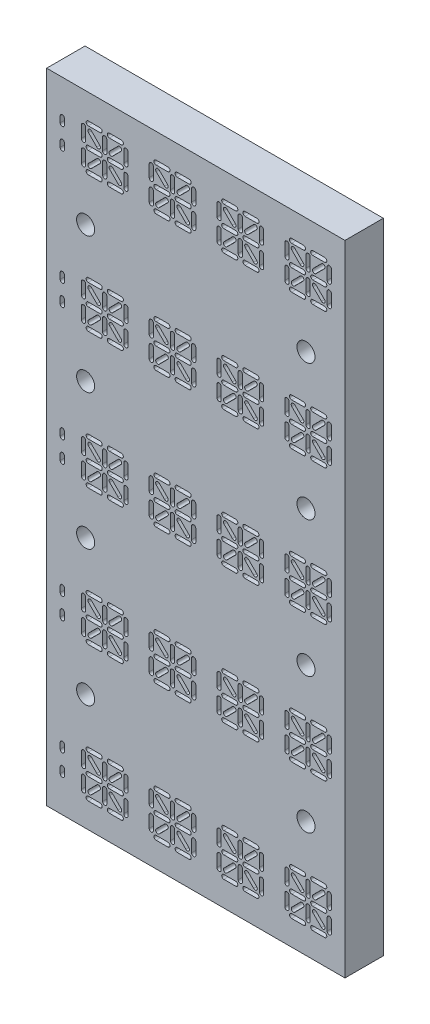
from build123d import *

# Parameters (mm, degrees)
SKETCH1_W             = 44.704
SKETCH1_H             = 11.90752
BOSS_EXTRUDE1_DEPTH   = 5.7531
LPATTERN1_COUNT       = 5
LPATTERN1_PITCH       = 20.32
SKETCH2_W             = 44.704
SKETCH2_H             = 8.41248
SKETCH2_H_2           = 1.27
BOSS_EXTRUDE2_DEPTH   = 5.7531
F_2_CLEARANCE_HOLE1_D = 2.7051


with BuildPart() as part:
    # Sketch1 → Boss-Extrude1 (new body)
    with BuildSketch(Plane.XY):
        with Locations((313.537231739, 231.557630322)):
            Rectangle(SKETCH1_W, SKETCH1_H)
        with BuildLine():
            Line((297.417977684, 228.700130322), (299.195977684, 228.700130322))
            ThreePointArc((299.195977684, 228.700130322), (299.513477684, 228.382630322), (299.195977684, 228.065130322))
            Line((299.195977684, 228.065130322), (297.417977684, 228.065130322))
            ThreePointArc((297.417977684, 228.065130322), (297.100477684, 228.382630322), (297.417977684, 228.700130322))
        make_face(mode=Mode.SUBTRACT)
        with BuildLine():
            Line((300.592977684, 228.700130322), (302.370977684, 228.700130322))
            ThreePointArc((302.370977684, 228.700130322), (302.688477684, 228.382630322), (302.370977684, 228.065130322))
            Line((302.370977684, 228.065130322), (300.592977684, 228.065130322))
            ThreePointArc((300.592977684, 228.065130322), (300.275477684, 228.382630322), (300.592977684, 228.700130322))
        make_face(mode=Mode.SUBTRACT)
        with BuildLine():
            Line((301.890962182, 229.11700599), (300.633726325, 230.374241847))
            ThreePointArc((300.633726325, 230.374241847), (300.633726325, 230.823254654), (301.082739131, 230.823254654))
            Line((301.082739131, 230.823254654), (302.339974988, 229.566018797))
            ThreePointArc((302.339974988, 229.566018797), (302.339974988, 229.11700599), (301.890962182, 229.11700599))
        make_face(mode=Mode.SUBTRACT)
        with BuildLine():
            Line((299.567231739, 229.081130322), (299.567231739, 230.859130322))
            ThreePointArc((299.567231739, 230.859130322), (299.884731739, 231.176630322), (300.202231739, 230.859130322))
            Line((300.202231739, 230.859130322), (300.202231739, 229.081130322))
            ThreePointArc((300.202231739, 229.081130322), (299.884731739, 228.763630322), (299.567231739, 229.081130322))
        make_face(mode=Mode.SUBTRACT)
        with BuildLine():
            Line((299.160102016, 230.369368875), (297.902866159, 229.112133018))
            ThreePointArc((297.902866159, 229.112133018), (297.453853353, 229.112133018), (297.453853353, 229.561145824))
            Line((297.453853353, 229.561145824), (298.71108921, 230.818381681))
            ThreePointArc((298.71108921, 230.818381681), (299.160102016, 230.818381681), (299.160102016, 230.369368875))
        make_face(mode=Mode.SUBTRACT)
        with BuildLine():
            Line((296.392231739, 229.081130322), (296.392231739, 230.859130322))
            ThreePointArc((296.392231739, 230.859130322), (296.709731739, 231.176630322), (297.027231739, 230.859130322))
            Line((297.027231739, 230.859130322), (297.027231739, 229.081130322))
            ThreePointArc((297.027231739, 229.081130322), (296.709731739, 228.763630322), (296.392231739, 229.081130322))
        make_face(mode=Mode.SUBTRACT)
        with BuildLine():
            Line((303.377231739, 230.859130322), (303.377231739, 229.081130322))
            ThreePointArc((303.377231739, 229.081130322), (303.059731739, 228.763630322), (302.742231739, 229.081130322))
            Line((302.742231739, 229.081130322), (302.742231739, 230.859130322))
            ThreePointArc((302.742231739, 230.859130322), (303.059731739, 231.176630322), (303.377231739, 230.859130322))
        make_face(mode=Mode.SUBTRACT)
        with BuildLine():
            Line((302.370977684, 231.240130322), (300.592977684, 231.240130322))
            ThreePointArc((300.592977684, 231.240130322), (300.275477684, 231.557630322), (300.592977684, 231.875130322))
            Line((300.592977684, 231.875130322), (302.370977684, 231.875130322))
            ThreePointArc((302.370977684, 231.875130322), (302.688477684, 231.557630322), (302.370977684, 231.240130322))
        make_face(mode=Mode.SUBTRACT)
        with BuildLine():
            Line((303.377231739, 234.034130322), (303.377231739, 232.256130322))
            ThreePointArc((303.377231739, 232.256130322), (303.059731739, 231.938630322), (302.742231739, 232.256130322))
            Line((302.742231739, 232.256130322), (302.742231739, 234.034130322))
            ThreePointArc((302.742231739, 234.034130322), (303.059731739, 234.351630322), (303.377231739, 234.034130322))
        make_face(mode=Mode.SUBTRACT)
        with BuildLine():
            Line((302.335102016, 233.55411482), (301.077866159, 232.296878963))
            ThreePointArc((301.077866159, 232.296878963), (300.628853353, 232.296878963), (300.628853353, 232.745891769))
            Line((300.628853353, 232.745891769), (301.88608921, 234.003127626))
            ThreePointArc((301.88608921, 234.003127626), (302.335102016, 234.003127626), (302.335102016, 233.55411482))
        make_face(mode=Mode.SUBTRACT)
        with BuildLine():
            Line((302.370977684, 234.415130322), (300.592977684, 234.415130322))
            ThreePointArc((300.592977684, 234.415130322), (300.275477684, 234.732630322), (300.592977684, 235.050130322))
            Line((300.592977684, 235.050130322), (302.370977684, 235.050130322))
            ThreePointArc((302.370977684, 235.050130322), (302.688477684, 234.732630322), (302.370977684, 234.415130322))
        make_face(mode=Mode.SUBTRACT)
        with BuildLine():
            Line((300.202231739, 234.034130322), (300.202231739, 232.256130322))
            ThreePointArc((300.202231739, 232.256130322), (299.884731739, 231.938630322), (299.567231739, 232.256130322))
            Line((299.567231739, 232.256130322), (299.567231739, 234.034130322))
            ThreePointArc((299.567231739, 234.034130322), (299.884731739, 234.351630322), (300.202231739, 234.034130322))
        make_face(mode=Mode.SUBTRACT)
        with BuildLine():
            Line((297.417977684, 231.875130322), (299.195977684, 231.875130322))
            ThreePointArc((299.195977684, 231.875130322), (299.513477684, 231.557630322), (299.195977684, 231.240130322))
            Line((299.195977684, 231.240130322), (297.417977684, 231.240130322))
            ThreePointArc((297.417977684, 231.240130322), (297.100477684, 231.557630322), (297.417977684, 231.875130322))
        make_face(mode=Mode.SUBTRACT)
        with BuildLine():
            Line((298.706216237, 232.29200599), (297.44898038, 233.549241847))
            ThreePointArc((297.44898038, 233.549241847), (297.44898038, 233.998254654), (297.897993186, 233.998254654))
            Line((297.897993186, 233.998254654), (299.155229043, 232.741018797))
            ThreePointArc((299.155229043, 232.741018797), (299.155229043, 232.29200599), (298.706216237, 232.29200599))
        make_face(mode=Mode.SUBTRACT)
        with BuildLine():
            Line((296.392231739, 232.256130322), (296.392231739, 234.034130322))
            ThreePointArc((296.392231739, 234.034130322), (296.709731739, 234.351630322), (297.027231739, 234.034130322))
            Line((297.027231739, 234.034130322), (297.027231739, 232.256130322))
            ThreePointArc((297.027231739, 232.256130322), (296.709731739, 231.938630322), (296.392231739, 232.256130322))
        make_face(mode=Mode.SUBTRACT)
        with BuildLine():
            Line((297.417977684, 235.050130322), (299.195977684, 235.050130322))
            ThreePointArc((299.195977684, 235.050130322), (299.513477684, 234.732630322), (299.195977684, 234.415130322))
            Line((299.195977684, 234.415130322), (297.417977684, 234.415130322))
            ThreePointArc((297.417977684, 234.415130322), (297.100477684, 234.732630322), (297.417977684, 235.050130322))
        make_face(mode=Mode.SUBTRACT)
        with BuildLine():
            Line((293.217231739, 232.700630322), (293.217231739, 233.589630322))
            ThreePointArc((293.217231739, 233.589630322), (293.534731739, 233.907130322), (293.852231739, 233.589630322))
            Line((293.852231739, 233.589630322), (293.852231739, 232.700630322))
            ThreePointArc((293.852231739, 232.700630322), (293.534731739, 232.383130322), (293.217231739, 232.700630322))
        make_face(mode=Mode.SUBTRACT)
        with BuildLine():
            Line((293.852231739, 230.414630322), (293.852231739, 229.525630322))
            ThreePointArc((293.852231739, 229.525630322), (293.534731739, 229.208130322), (293.217231739, 229.525630322))
            Line((293.217231739, 229.525630322), (293.217231739, 230.414630322))
            ThreePointArc((293.217231739, 230.414630322), (293.534731739, 230.732130322), (293.852231739, 230.414630322))
        make_face(mode=Mode.SUBTRACT)
        with BuildLine():
            Line((307.577977684, 228.700130322), (309.355977684, 228.700130322))
            ThreePointArc((309.355977684, 228.700130322), (309.673477684, 228.382630322), (309.355977684, 228.065130322))
            Line((309.355977684, 228.065130322), (307.577977684, 228.065130322))
            ThreePointArc((307.577977684, 228.065130322), (307.260477684, 228.382630322), (307.577977684, 228.700130322))
        make_face(mode=Mode.SUBTRACT)
        with BuildLine():
            Line((310.752977684, 228.700130322), (312.530977684, 228.700130322))
            ThreePointArc((312.530977684, 228.700130322), (312.848477684, 228.382630322), (312.530977684, 228.065130322))
            Line((312.530977684, 228.065130322), (310.752977684, 228.065130322))
            ThreePointArc((310.752977684, 228.065130322), (310.435477684, 228.382630322), (310.752977684, 228.700130322))
        make_face(mode=Mode.SUBTRACT)
        with BuildLine():
            Line((312.050962182, 229.11700599), (310.793726325, 230.374241847))
            ThreePointArc((310.793726325, 230.374241847), (310.793726325, 230.823254654), (311.242739131, 230.823254654))
            Line((311.242739131, 230.823254654), (312.499974988, 229.566018797))
            ThreePointArc((312.499974988, 229.566018797), (312.499974988, 229.11700599), (312.050962182, 229.11700599))
        make_face(mode=Mode.SUBTRACT)
        with BuildLine():
            Line((309.727231739, 229.081130322), (309.727231739, 230.859130322))
            ThreePointArc((309.727231739, 230.859130322), (310.044731739, 231.176630322), (310.362231739, 230.859130322))
            Line((310.362231739, 230.859130322), (310.362231739, 229.081130322))
            ThreePointArc((310.362231739, 229.081130322), (310.044731739, 228.763630322), (309.727231739, 229.081130322))
        make_face(mode=Mode.SUBTRACT)
        with BuildLine():
            Line((309.320102016, 230.369368875), (308.062866159, 229.112133018))
            ThreePointArc((308.062866159, 229.112133018), (307.613853353, 229.112133018), (307.613853353, 229.561145824))
            Line((307.613853353, 229.561145824), (308.87108921, 230.818381681))
            ThreePointArc((308.87108921, 230.818381681), (309.320102016, 230.818381681), (309.320102016, 230.369368875))
        make_face(mode=Mode.SUBTRACT)
        with BuildLine():
            Line((306.552231739, 229.081130322), (306.552231739, 230.859130322))
            ThreePointArc((306.552231739, 230.859130322), (306.869731739, 231.176630322), (307.187231739, 230.859130322))
            Line((307.187231739, 230.859130322), (307.187231739, 229.081130322))
            ThreePointArc((307.187231739, 229.081130322), (306.869731739, 228.763630322), (306.552231739, 229.081130322))
        make_face(mode=Mode.SUBTRACT)
        with BuildLine():
            Line((313.537231739, 230.859130322), (313.537231739, 229.081130322))
            ThreePointArc((313.537231739, 229.081130322), (313.219731739, 228.763630322), (312.902231739, 229.081130322))
            Line((312.902231739, 229.081130322), (312.902231739, 230.859130322))
            ThreePointArc((312.902231739, 230.859130322), (313.219731739, 231.176630322), (313.537231739, 230.859130322))
        make_face(mode=Mode.SUBTRACT)
        with BuildLine():
            Line((312.530977684, 231.240130322), (310.752977684, 231.240130322))
            ThreePointArc((310.752977684, 231.240130322), (310.435477684, 231.557630322), (310.752977684, 231.875130322))
            Line((310.752977684, 231.875130322), (312.530977684, 231.875130322))
            ThreePointArc((312.530977684, 231.875130322), (312.848477684, 231.557630322), (312.530977684, 231.240130322))
        make_face(mode=Mode.SUBTRACT)
        with BuildLine():
            Line((313.537231739, 234.034130322), (313.537231739, 232.256130322))
            ThreePointArc((313.537231739, 232.256130322), (313.219731739, 231.938630322), (312.902231739, 232.256130322))
            Line((312.902231739, 232.256130322), (312.902231739, 234.034130322))
            ThreePointArc((312.902231739, 234.034130322), (313.219731739, 234.351630322), (313.537231739, 234.034130322))
        make_face(mode=Mode.SUBTRACT)
        with BuildLine():
            Line((312.495102016, 233.55411482), (311.237866159, 232.296878963))
            ThreePointArc((311.237866159, 232.296878963), (310.788853353, 232.296878963), (310.788853353, 232.745891769))
            Line((310.788853353, 232.745891769), (312.04608921, 234.003127626))
            ThreePointArc((312.04608921, 234.003127626), (312.495102016, 234.003127626), (312.495102016, 233.55411482))
        make_face(mode=Mode.SUBTRACT)
        with BuildLine():
            Line((312.530977684, 234.415130322), (310.752977684, 234.415130322))
            ThreePointArc((310.752977684, 234.415130322), (310.435477684, 234.732630322), (310.752977684, 235.050130322))
            Line((310.752977684, 235.050130322), (312.530977684, 235.050130322))
            ThreePointArc((312.530977684, 235.050130322), (312.848477684, 234.732630322), (312.530977684, 234.415130322))
        make_face(mode=Mode.SUBTRACT)
        with BuildLine():
            Line((310.362231739, 234.034130322), (310.362231739, 232.256130322))
            ThreePointArc((310.362231739, 232.256130322), (310.044731739, 231.938630322), (309.727231739, 232.256130322))
            Line((309.727231739, 232.256130322), (309.727231739, 234.034130322))
            ThreePointArc((309.727231739, 234.034130322), (310.044731739, 234.351630322), (310.362231739, 234.034130322))
        make_face(mode=Mode.SUBTRACT)
        with BuildLine():
            Line((307.577977684, 231.875130322), (309.355977684, 231.875130322))
            ThreePointArc((309.355977684, 231.875130322), (309.673477684, 231.557630322), (309.355977684, 231.240130322))
            Line((309.355977684, 231.240130322), (307.577977684, 231.240130322))
            ThreePointArc((307.577977684, 231.240130322), (307.260477684, 231.557630322), (307.577977684, 231.875130322))
        make_face(mode=Mode.SUBTRACT)
        with BuildLine():
            Line((308.866216237, 232.29200599), (307.60898038, 233.549241847))
            ThreePointArc((307.60898038, 233.549241847), (307.60898038, 233.998254654), (308.057993186, 233.998254654))
            Line((308.057993186, 233.998254654), (309.315229043, 232.741018797))
            ThreePointArc((309.315229043, 232.741018797), (309.315229043, 232.29200599), (308.866216237, 232.29200599))
        make_face(mode=Mode.SUBTRACT)
        with BuildLine():
            Line((306.552231739, 232.256130322), (306.552231739, 234.034130322))
            ThreePointArc((306.552231739, 234.034130322), (306.869731739, 234.351630322), (307.187231739, 234.034130322))
            Line((307.187231739, 234.034130322), (307.187231739, 232.256130322))
            ThreePointArc((307.187231739, 232.256130322), (306.869731739, 231.938630322), (306.552231739, 232.256130322))
        make_face(mode=Mode.SUBTRACT)
        with BuildLine():
            Line((307.577977684, 235.050130322), (309.355977684, 235.050130322))
            ThreePointArc((309.355977684, 235.050130322), (309.673477684, 234.732630322), (309.355977684, 234.415130322))
            Line((309.355977684, 234.415130322), (307.577977684, 234.415130322))
            ThreePointArc((307.577977684, 234.415130322), (307.260477684, 234.732630322), (307.577977684, 235.050130322))
        make_face(mode=Mode.SUBTRACT)
        with BuildLine():
            Line((317.737977684, 228.700130322), (319.515977684, 228.700130322))
            ThreePointArc((319.515977684, 228.700130322), (319.833477684, 228.382630322), (319.515977684, 228.065130322))
            Line((319.515977684, 228.065130322), (317.737977684, 228.065130322))
            ThreePointArc((317.737977684, 228.065130322), (317.420477684, 228.382630322), (317.737977684, 228.700130322))
        make_face(mode=Mode.SUBTRACT)
        with BuildLine():
            Line((320.912977684, 228.700130322), (322.690977684, 228.700130322))
            ThreePointArc((322.690977684, 228.700130322), (323.008477684, 228.382630322), (322.690977684, 228.065130322))
            Line((322.690977684, 228.065130322), (320.912977684, 228.065130322))
            ThreePointArc((320.912977684, 228.065130322), (320.595477684, 228.382630322), (320.912977684, 228.700130322))
        make_face(mode=Mode.SUBTRACT)
        with BuildLine():
            Line((322.210962182, 229.11700599), (320.953726325, 230.374241847))
            ThreePointArc((320.953726325, 230.374241847), (320.953726325, 230.823254654), (321.402739131, 230.823254654))
            Line((321.402739131, 230.823254654), (322.659974988, 229.566018797))
            ThreePointArc((322.659974988, 229.566018797), (322.659974988, 229.11700599), (322.210962182, 229.11700599))
        make_face(mode=Mode.SUBTRACT)
        with BuildLine():
            Line((319.887231739, 229.081130322), (319.887231739, 230.859130322))
            ThreePointArc((319.887231739, 230.859130322), (320.204731739, 231.176630322), (320.522231739, 230.859130322))
            Line((320.522231739, 230.859130322), (320.522231739, 229.081130322))
            ThreePointArc((320.522231739, 229.081130322), (320.204731739, 228.763630322), (319.887231739, 229.081130322))
        make_face(mode=Mode.SUBTRACT)
        with BuildLine():
            Line((319.480102016, 230.369368875), (318.222866159, 229.112133018))
            ThreePointArc((318.222866159, 229.112133018), (317.773853353, 229.112133018), (317.773853353, 229.561145824))
            Line((317.773853353, 229.561145824), (319.03108921, 230.818381681))
            ThreePointArc((319.03108921, 230.818381681), (319.480102016, 230.818381681), (319.480102016, 230.369368875))
        make_face(mode=Mode.SUBTRACT)
        with BuildLine():
            Line((316.712231739, 229.081130322), (316.712231739, 230.859130322))
            ThreePointArc((316.712231739, 230.859130322), (317.029731739, 231.176630322), (317.347231739, 230.859130322))
            Line((317.347231739, 230.859130322), (317.347231739, 229.081130322))
            ThreePointArc((317.347231739, 229.081130322), (317.029731739, 228.763630322), (316.712231739, 229.081130322))
        make_face(mode=Mode.SUBTRACT)
        with BuildLine():
            Line((323.697231739, 230.859130322), (323.697231739, 229.081130322))
            ThreePointArc((323.697231739, 229.081130322), (323.379731739, 228.763630322), (323.062231739, 229.081130322))
            Line((323.062231739, 229.081130322), (323.062231739, 230.859130322))
            ThreePointArc((323.062231739, 230.859130322), (323.379731739, 231.176630322), (323.697231739, 230.859130322))
        make_face(mode=Mode.SUBTRACT)
        with BuildLine():
            Line((322.690977684, 231.240130322), (320.912977684, 231.240130322))
            ThreePointArc((320.912977684, 231.240130322), (320.595477684, 231.557630322), (320.912977684, 231.875130322))
            Line((320.912977684, 231.875130322), (322.690977684, 231.875130322))
            ThreePointArc((322.690977684, 231.875130322), (323.008477684, 231.557630322), (322.690977684, 231.240130322))
        make_face(mode=Mode.SUBTRACT)
        with BuildLine():
            Line((323.697231739, 234.034130322), (323.697231739, 232.256130322))
            ThreePointArc((323.697231739, 232.256130322), (323.379731739, 231.938630322), (323.062231739, 232.256130322))
            Line((323.062231739, 232.256130322), (323.062231739, 234.034130322))
            ThreePointArc((323.062231739, 234.034130322), (323.379731739, 234.351630322), (323.697231739, 234.034130322))
        make_face(mode=Mode.SUBTRACT)
        with BuildLine():
            Line((322.655102016, 233.55411482), (321.397866159, 232.296878963))
            ThreePointArc((321.397866159, 232.296878963), (320.948853353, 232.296878963), (320.948853353, 232.745891769))
            Line((320.948853353, 232.745891769), (322.20608921, 234.003127626))
            ThreePointArc((322.20608921, 234.003127626), (322.655102016, 234.003127626), (322.655102016, 233.55411482))
        make_face(mode=Mode.SUBTRACT)
        with BuildLine():
            Line((322.690977684, 234.415130322), (320.912977684, 234.415130322))
            ThreePointArc((320.912977684, 234.415130322), (320.595477684, 234.732630322), (320.912977684, 235.050130322))
            Line((320.912977684, 235.050130322), (322.690977684, 235.050130322))
            ThreePointArc((322.690977684, 235.050130322), (323.008477684, 234.732630322), (322.690977684, 234.415130322))
        make_face(mode=Mode.SUBTRACT)
        with BuildLine():
            Line((320.522231739, 234.034130322), (320.522231739, 232.256130322))
            ThreePointArc((320.522231739, 232.256130322), (320.204731739, 231.938630322), (319.887231739, 232.256130322))
            Line((319.887231739, 232.256130322), (319.887231739, 234.034130322))
            ThreePointArc((319.887231739, 234.034130322), (320.204731739, 234.351630322), (320.522231739, 234.034130322))
        make_face(mode=Mode.SUBTRACT)
        with BuildLine():
            Line((317.737977684, 231.875130322), (319.515977684, 231.875130322))
            ThreePointArc((319.515977684, 231.875130322), (319.833477684, 231.557630322), (319.515977684, 231.240130322))
            Line((319.515977684, 231.240130322), (317.737977684, 231.240130322))
            ThreePointArc((317.737977684, 231.240130322), (317.420477684, 231.557630322), (317.737977684, 231.875130322))
        make_face(mode=Mode.SUBTRACT)
        with BuildLine():
            Line((319.026216237, 232.29200599), (317.76898038, 233.549241847))
            ThreePointArc((317.76898038, 233.549241847), (317.76898038, 233.998254654), (318.217993186, 233.998254654))
            Line((318.217993186, 233.998254654), (319.475229043, 232.741018797))
            ThreePointArc((319.475229043, 232.741018797), (319.475229043, 232.29200599), (319.026216237, 232.29200599))
        make_face(mode=Mode.SUBTRACT)
        with BuildLine():
            Line((316.712231739, 232.256130322), (316.712231739, 234.034130322))
            ThreePointArc((316.712231739, 234.034130322), (317.029731739, 234.351630322), (317.347231739, 234.034130322))
            Line((317.347231739, 234.034130322), (317.347231739, 232.256130322))
            ThreePointArc((317.347231739, 232.256130322), (317.029731739, 231.938630322), (316.712231739, 232.256130322))
        make_face(mode=Mode.SUBTRACT)
        with BuildLine():
            Line((317.737977684, 235.050130322), (319.515977684, 235.050130322))
            ThreePointArc((319.515977684, 235.050130322), (319.833477684, 234.732630322), (319.515977684, 234.415130322))
            Line((319.515977684, 234.415130322), (317.737977684, 234.415130322))
            ThreePointArc((317.737977684, 234.415130322), (317.420477684, 234.732630322), (317.737977684, 235.050130322))
        make_face(mode=Mode.SUBTRACT)
        with BuildLine():
            Line((327.897977684, 228.700130322), (329.675977684, 228.700130322))
            ThreePointArc((329.675977684, 228.700130322), (329.993477684, 228.382630322), (329.675977684, 228.065130322))
            Line((329.675977684, 228.065130322), (327.897977684, 228.065130322))
            ThreePointArc((327.897977684, 228.065130322), (327.580477684, 228.382630322), (327.897977684, 228.700130322))
        make_face(mode=Mode.SUBTRACT)
        with BuildLine():
            Line((331.072977684, 228.700130322), (332.850977684, 228.700130322))
            ThreePointArc((332.850977684, 228.700130322), (333.168477684, 228.382630322), (332.850977684, 228.065130322))
            Line((332.850977684, 228.065130322), (331.072977684, 228.065130322))
            ThreePointArc((331.072977684, 228.065130322), (330.755477684, 228.382630322), (331.072977684, 228.700130322))
        make_face(mode=Mode.SUBTRACT)
        with BuildLine():
            Line((332.370962182, 229.11700599), (331.113726325, 230.374241847))
            ThreePointArc((331.113726325, 230.374241847), (331.113726325, 230.823254654), (331.562739131, 230.823254654))
            Line((331.562739131, 230.823254654), (332.819974988, 229.566018797))
            ThreePointArc((332.819974988, 229.566018797), (332.819974988, 229.11700599), (332.370962182, 229.11700599))
        make_face(mode=Mode.SUBTRACT)
        with BuildLine():
            Line((330.047231739, 229.081130322), (330.047231739, 230.859130322))
            ThreePointArc((330.047231739, 230.859130322), (330.364731739, 231.176630322), (330.682231739, 230.859130322))
            Line((330.682231739, 230.859130322), (330.682231739, 229.081130322))
            ThreePointArc((330.682231739, 229.081130322), (330.364731739, 228.763630322), (330.047231739, 229.081130322))
        make_face(mode=Mode.SUBTRACT)
        with BuildLine():
            Line((329.640102016, 230.369368875), (328.382866159, 229.112133018))
            ThreePointArc((328.382866159, 229.112133018), (327.933853353, 229.112133018), (327.933853353, 229.561145824))
            Line((327.933853353, 229.561145824), (329.19108921, 230.818381681))
            ThreePointArc((329.19108921, 230.818381681), (329.640102016, 230.818381681), (329.640102016, 230.369368875))
        make_face(mode=Mode.SUBTRACT)
        with BuildLine():
            Line((326.872231739, 229.081130322), (326.872231739, 230.859130322))
            ThreePointArc((326.872231739, 230.859130322), (327.189731739, 231.176630322), (327.507231739, 230.859130322))
            Line((327.507231739, 230.859130322), (327.507231739, 229.081130322))
            ThreePointArc((327.507231739, 229.081130322), (327.189731739, 228.763630322), (326.872231739, 229.081130322))
        make_face(mode=Mode.SUBTRACT)
        with BuildLine():
            Line((333.857231739, 230.859130322), (333.857231739, 229.081130322))
            ThreePointArc((333.857231739, 229.081130322), (333.539731739, 228.763630322), (333.222231739, 229.081130322))
            Line((333.222231739, 229.081130322), (333.222231739, 230.859130322))
            ThreePointArc((333.222231739, 230.859130322), (333.539731739, 231.176630322), (333.857231739, 230.859130322))
        make_face(mode=Mode.SUBTRACT)
        with BuildLine():
            Line((332.850977684, 231.240130322), (331.072977684, 231.240130322))
            ThreePointArc((331.072977684, 231.240130322), (330.755477684, 231.557630322), (331.072977684, 231.875130322))
            Line((331.072977684, 231.875130322), (332.850977684, 231.875130322))
            ThreePointArc((332.850977684, 231.875130322), (333.168477684, 231.557630322), (332.850977684, 231.240130322))
        make_face(mode=Mode.SUBTRACT)
        with BuildLine():
            Line((333.857231739, 234.034130322), (333.857231739, 232.256130322))
            ThreePointArc((333.857231739, 232.256130322), (333.539731739, 231.938630322), (333.222231739, 232.256130322))
            Line((333.222231739, 232.256130322), (333.222231739, 234.034130322))
            ThreePointArc((333.222231739, 234.034130322), (333.539731739, 234.351630322), (333.857231739, 234.034130322))
        make_face(mode=Mode.SUBTRACT)
        with BuildLine():
            Line((332.815102016, 233.55411482), (331.557866159, 232.296878963))
            ThreePointArc((331.557866159, 232.296878963), (331.108853353, 232.296878963), (331.108853353, 232.745891769))
            Line((331.108853353, 232.745891769), (332.36608921, 234.003127626))
            ThreePointArc((332.36608921, 234.003127626), (332.815102016, 234.003127626), (332.815102016, 233.55411482))
        make_face(mode=Mode.SUBTRACT)
        with BuildLine():
            Line((332.850977684, 234.415130322), (331.072977684, 234.415130322))
            ThreePointArc((331.072977684, 234.415130322), (330.755477684, 234.732630322), (331.072977684, 235.050130322))
            Line((331.072977684, 235.050130322), (332.850977684, 235.050130322))
            ThreePointArc((332.850977684, 235.050130322), (333.168477684, 234.732630322), (332.850977684, 234.415130322))
        make_face(mode=Mode.SUBTRACT)
        with BuildLine():
            Line((330.682231739, 234.034130322), (330.682231739, 232.256130322))
            ThreePointArc((330.682231739, 232.256130322), (330.364731739, 231.938630322), (330.047231739, 232.256130322))
            Line((330.047231739, 232.256130322), (330.047231739, 234.034130322))
            ThreePointArc((330.047231739, 234.034130322), (330.364731739, 234.351630322), (330.682231739, 234.034130322))
        make_face(mode=Mode.SUBTRACT)
        with BuildLine():
            Line((327.897977684, 231.875130322), (329.675977684, 231.875130322))
            ThreePointArc((329.675977684, 231.875130322), (329.993477684, 231.557630322), (329.675977684, 231.240130322))
            Line((329.675977684, 231.240130322), (327.897977684, 231.240130322))
            ThreePointArc((327.897977684, 231.240130322), (327.580477684, 231.557630322), (327.897977684, 231.875130322))
        make_face(mode=Mode.SUBTRACT)
        with BuildLine():
            Line((329.186216237, 232.29200599), (327.92898038, 233.549241847))
            ThreePointArc((327.92898038, 233.549241847), (327.92898038, 233.998254654), (328.377993186, 233.998254654))
            Line((328.377993186, 233.998254654), (329.635229043, 232.741018797))
            ThreePointArc((329.635229043, 232.741018797), (329.635229043, 232.29200599), (329.186216237, 232.29200599))
        make_face(mode=Mode.SUBTRACT)
        with BuildLine():
            Line((326.872231739, 232.256130322), (326.872231739, 234.034130322))
            ThreePointArc((326.872231739, 234.034130322), (327.189731739, 234.351630322), (327.507231739, 234.034130322))
            Line((327.507231739, 234.034130322), (327.507231739, 232.256130322))
            ThreePointArc((327.507231739, 232.256130322), (327.189731739, 231.938630322), (326.872231739, 232.256130322))
        make_face(mode=Mode.SUBTRACT)
        with BuildLine():
            Line((327.897977684, 235.050130322), (329.675977684, 235.050130322))
            ThreePointArc((329.675977684, 235.050130322), (329.993477684, 234.732630322), (329.675977684, 234.415130322))
            Line((329.675977684, 234.415130322), (327.897977684, 234.415130322))
            ThreePointArc((327.897977684, 234.415130322), (327.580477684, 234.732630322), (327.897977684, 235.050130322))
        make_face(mode=Mode.SUBTRACT)
    extrude(amount=BOSS_EXTRUDE1_DEPTH)


with BuildPart() as lpattern1_1:
    # LPattern1: pattern copy
    add(part.part.moved(Location(Vector(0, -1, 0) * (1 * LPATTERN1_PITCH))))


with BuildPart() as lpattern1_2:
    # LPattern1: pattern copy
    add(part.part.moved(Location(Vector(0, -1, 0) * (2 * LPATTERN1_PITCH))))


with BuildPart() as lpattern1_3:
    # LPattern1: pattern copy
    add(part.part.moved(Location(Vector(0, -1, 0) * (3 * LPATTERN1_PITCH))))


with BuildPart() as lpattern1_4:
    # LPattern1: pattern copy
    add(part.part.moved(Location(Vector(0, -1, 0) * (4 * LPATTERN1_PITCH))))


with BuildPart() as part_1:
    add(part.part)

    add(lpattern1_1.part)  # Boss-Extrude2 merges LPattern1_1

    add(lpattern1_2.part)  # Boss-Extrude2 merges LPattern1_2

    add(lpattern1_3.part)  # Boss-Extrude2 merges LPattern1_3

    add(lpattern1_4.part)  # Boss-Extrude2 merges LPattern1_4
    # Sketch2 → Boss-Extrude2 (add)
    with BuildSketch(Plane.XY.offset(5.7531)):
        with Locations((313.537231739, 221.397630322)):
            Rectangle(SKETCH2_W, SKETCH2_H)
        with Locations((313.537231739, 201.077630322)):
            Rectangle(SKETCH2_W, SKETCH2_H)
        with Locations((313.537231739, 180.757630322)):
            Rectangle(SKETCH2_W, SKETCH2_H)
        with Locations((313.537231739, 160.437630322)):
            Rectangle(SKETCH2_W, SKETCH2_H)
        with Locations((313.537231739, 238.146390322)):
            Rectangle(SKETCH2_W, SKETCH2_H_2)
        with Locations((313.537231739, 143.688870322)):
            Rectangle(SKETCH2_W, SKETCH2_H_2)
    extrude(amount=-BOSS_EXTRUDE2_DEPTH)

    # #2 Clearance Hole1 (through all)
    with Locations(Plane.XY.offset(5.7531)):
        with Locations((297.027231739, 221.398265322), (330.047231739, 221.398265322), (330.047231739, 201.078265322), (297.027231739, 201.078265322), (297.027231739, 180.758265322), (330.047231739, 180.758265322), (330.047231739, 160.438265322), (297.027231739, 160.438265322)):
            Hole(F_2_CLEARANCE_HOLE1_D / 2)


solid = part_1.part
